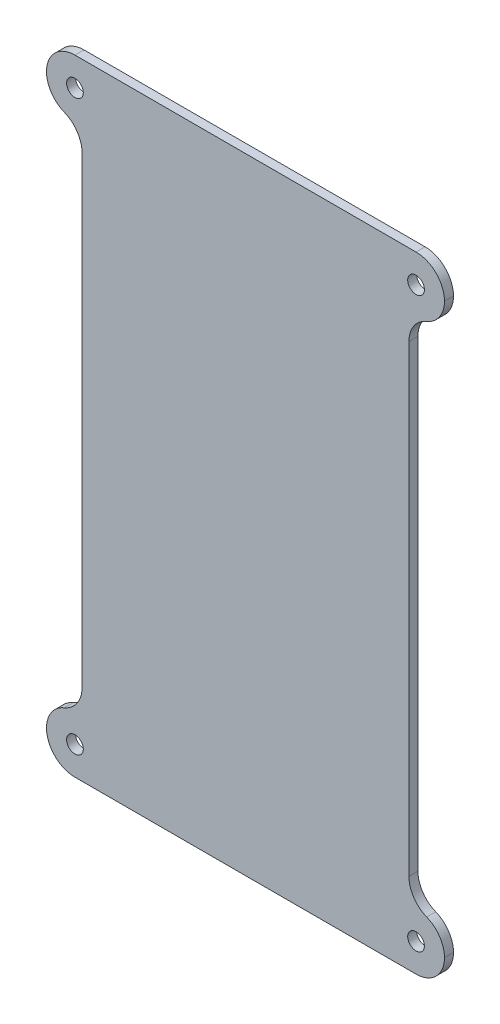
from build123d import *

# Parameters (mm, degrees)
SKETCH1_W           = 112
SKETCH1_H           = 176
SKETCH1_R           = 2.35
BOSS_EXTRUDE1_DEPTH = 2.54
FILLET1_R           = 8
SKETCH2_W           = 10
SKETCH2_H           = 144
CUT_EXTRUDE1_DEPTH  = 3.18
FILLET2_R           = 8
FILLET3_R           = 8


with BuildPart() as part:
    # Sketch1 → Boss-Extrude1 (new body)
    with BuildSketch(Plane.XY):
        Rectangle(SKETCH1_W, SKETCH1_H)
        with Locations((-48, 80)):
            Circle(SKETCH1_R, mode=Mode.SUBTRACT)
        with Locations((48, 80)):
            Circle(SKETCH1_R, mode=Mode.SUBTRACT)
        with Locations((48, -80)):
            Circle(SKETCH1_R, mode=Mode.SUBTRACT)
        with Locations((-48, -80)):
            Circle(SKETCH1_R, mode=Mode.SUBTRACT)
    extrude(amount=BOSS_EXTRUDE1_DEPTH)

    # Fillet1
    fillet1_edges = [part.edges().sort_by_distance(p)[0] for p in [
        (56, -88, 1.27),
        (-56, -88, 1.27),
        (-56, 88, 1.27),
        (56, 88, 1.27),
    ]]
    fillet(fillet1_edges, radius=FILLET1_R)

    # Sketch2 → Cut-Extrude1 (cut)
    with BuildSketch(Plane.XY.offset(2.54)):
        with Locations((-51, 0)):
            Rectangle(SKETCH2_W, SKETCH2_H)
        with Locations((51, 0)):
            Rectangle(SKETCH2_W, SKETCH2_H)
    extrude(amount=-CUT_EXTRUDE1_DEPTH, mode=Mode.SUBTRACT)

    # Fillet2
    fillet2_edges = [part.edges().sort_by_distance(p)[0] for p in [
        (56, 72, 1.27),
        (56, -72, 1.27),
        (-56, -72, 1.27),
        (-56, 72, 1.27),
    ]]
    fillet(fillet2_edges, radius=FILLET2_R - 0.0001)  # a hair under: the kernel refuses the full size

    # Fillet3
    fillet3_edges = [part.edges().sort_by_distance(p)[0] for p in [
        (46, -72, 1.27),
        (46, 72, 1.27),
        (-46, 72, 1.27),
        (-46, -72, 1.27),
    ]]
    fillet(fillet3_edges, radius=FILLET3_R)


solid = part.part
